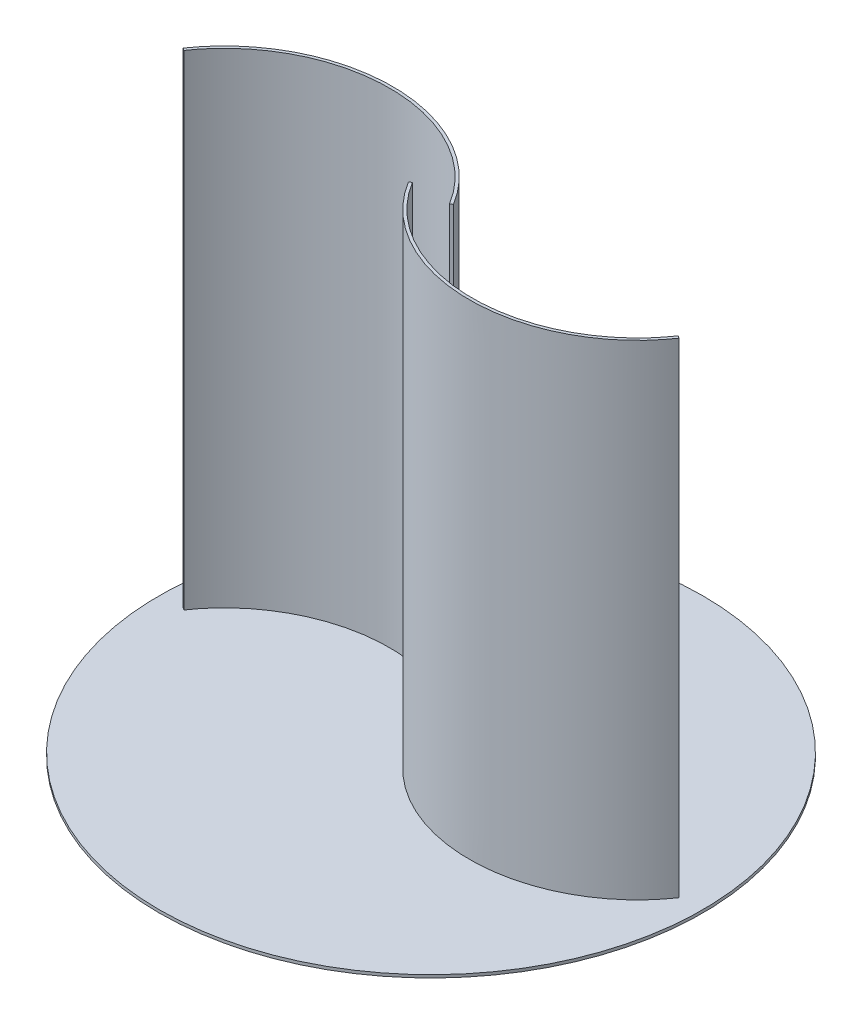
from build123d import *

# Parameters (mm, degrees)
EXTRUIR_L_MINA1_DEPTH      = 500
CROQUIS2_R                 = 280.5
SALIENTE_EXTRUIR8_DEPTH    = 3
S_LIDO_MOVER_COPIAR1_ANGLE = 90
S_LIDO_MOVER_COPIAR4_ANGLE = 30
S_LIDO_MOVER_COPIAR5_ANGLE = 60


# Read off the part's stored shape, not the designer's step: Extruir-Lámina1
with BuildPart() as part:
    # Extruir-Lámina1 outline → Extruir-Lámina1 (new body)
    with BuildSketch(Plane(origin=(0, 0, 0), x_dir=(1, 0, 0), z_dir=(0, 1, 0))):
        with BuildLine():
            Line((19.125, 0), (21.689121639, 1.55733112))
            add(Edge.make_bspline(
                [(21.689121639, 1.55733112), (18.27456602, 7.179344216), (14.468567133, 12.58146888), (6.137000956, 22.857201022), (1.611477285, 27.730763019), (-8.083958794, 36.869602289), (-13.2538227, 41.134841579), (-24.152360559, 48.987598355), (-29.880982541, 52.57508506), (-41.802571029, 59.014260096), (-47.995483026, 61.86592441), (-60.743899677, 66.787558946), (-67.299347885, 68.857511587), (-80.66546522, 72.182630798), (-87.476076438, 73.437786088), (-101.241245358, 75.113454945), (-108.195744184, 75.533963547), (-122.135265016, 75.533963547), (-129.120227784, 75.11345637), (-143.006878519, 73.438582894), (-149.908507595, 72.184224449), (-163.516093081, 68.862201003), (-170.221991731, 66.794550222), (-183.32887145, 61.879557712), (-189.72979668, 59.032236383), (-202.122344676, 52.60406126), (-208.113914261, 49.023233744), (-219.589864266, 41.186046151), (-225.074194803, 36.929717852), (-235.445826562, 27.810497666), (-240.333081724, 22.947642672), (-249.430210223, 12.694275615), (-253.640041761, 7.303805252), (-257.476409721, 1.693338387)],
                knots=[0, 0, 0, 0, 0.0625, 0.0625, 0.125, 0.125, 0.1875, 0.1875, 0.25, 0.25, 0.3125, 0.3125, 0.375, 0.375, 0.4375, 0.4375, 0.5, 0.5, 0.5625, 0.5625, 0.625, 0.625, 0.6875, 0.6875, 0.75, 0.75, 0.8125, 0.8125, 0.875, 0.875, 0.9375, 0.9375, 1, 1, 1, 1], degree=3))
            Line((-257.476409721, 1.693338387), (-255, 0))
            add(Edge.make_bspline(
                [(19.125, 0), (-109.823674921, 212.312001871), (-255, 0)],
                knots=[3.406864615, 3.406864615, 3.406864615, 5.457277421, 5.457277421, 5.457277421], degree=2, weights=[1, 0.51892246, 1]))
        make_face()
        with BuildLine():
            Line((-19.125, 0), (-21.689121639, -1.55733112))
            add(Edge.make_bspline(
                [(-21.689121639, -1.55733112), (-18.27456602, -7.179344216), (-14.468567133, -12.58146888), (-6.137000956, -22.857201022), (-1.611477285, -27.730763019), (8.083958794, -36.869602289), (13.2538227, -41.134841579), (24.152360559, -48.987598355), (29.880982541, -52.57508506), (41.802571029, -59.014260096), (47.995483026, -61.86592441), (60.743899677, -66.787558946), (67.299347885, -68.857511587), (80.66546522, -72.182630798), (87.476076438, -73.437786088), (101.241245358, -75.113454945), (108.195744184, -75.533963547), (122.135265016, -75.533963547), (129.120227784, -75.11345637), (143.006878519, -73.438582894), (149.908507595, -72.184224449), (163.516093081, -68.862201003), (170.221991731, -66.794550222), (183.32887145, -61.879557712), (189.72979668, -59.032236383), (202.122344676, -52.60406126), (208.113914261, -49.023233744), (219.589864266, -41.186046151), (225.074194803, -36.929717852), (235.445826562, -27.810497666), (240.333081724, -22.947642672), (249.430210223, -12.694275615), (253.640041761, -7.303805252), (257.476409721, -1.693338387)],
                knots=[0, 0, 0, 0, 0.0625, 0.0625, 0.125, 0.125, 0.1875, 0.1875, 0.25, 0.25, 0.3125, 0.3125, 0.375, 0.375, 0.4375, 0.4375, 0.5, 0.5, 0.5625, 0.5625, 0.625, 0.625, 0.6875, 0.6875, 0.75, 0.75, 0.8125, 0.8125, 0.875, 0.875, 0.9375, 0.9375, 1, 1, 1, 1], degree=3))
            Line((257.476409721, -1.693338387), (255, 0))
            add(Edge.make_bspline(
                [(-19.125, 0), (109.823674921, -212.312001871), (255, 0)],
                knots=[3.406864615, 3.406864615, 3.406864615, 5.457277421, 5.457277421, 5.457277421], degree=2, weights=[1, 0.51892246, 1]))
        make_face()
    extrude(amount=EXTRUIR_L_MINA1_DEPTH)

    # Croquis2 → Saliente-Extruir8 (add)
    with BuildSketch(Plane.XZ):
        with Locations(Location((0, 0, 0), (0, 0, 270))):
            Circle(CROQUIS2_R)
    extrude(amount=SALIENTE_EXTRUIR8_DEPTH)


with BuildPart() as part_1:
    # Sólido-Mover/Copiar1: moved
    add(part.part.rotate(Axis((0, 0, 0), (0, -1, 0)), S_LIDO_MOVER_COPIAR1_ANGLE))


with BuildPart() as part_2:
    # Sólido-Mover/Copiar4: moved
    add(part_1.part.rotate(Axis((0, 0, 0), (0, 1, 0)), S_LIDO_MOVER_COPIAR4_ANGLE))


with BuildPart() as part_3:
    # Sólido-Mover/Copiar5: moved
    add(part_2.part.rotate(Axis((0, 0, 0), (0, 1, 0)), S_LIDO_MOVER_COPIAR5_ANGLE))


solid = part_3.part
